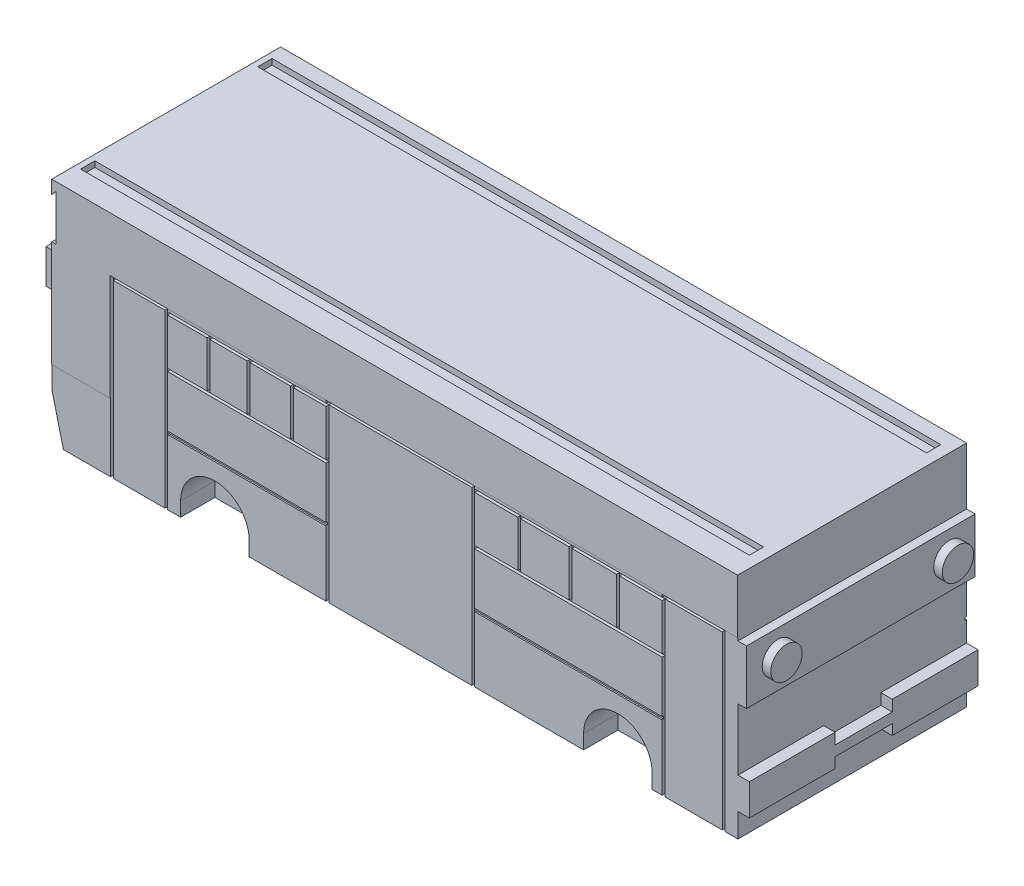
from build123d import *

# Parameters (mm, degrees)
BOSS_EXTRUDE2_DEPTH           = 40
CUT_EXTRUDE3_DEPTH            = 6
CUT_EXTRUDE4_DEPTH            = 6
CUT_EXTRUDE5_START            = -6
CUT_EXTRUDE5_DEPTH            = 6
CUT_EXTRUDE_THIN7_START       = -0.5
CUT_EXTRUDE_THIN7_OUTLINE_W   = 6.885880552
CUT_EXTRUDE_THIN7_OUTLINE_H   = 8.068048293
CUT_EXTRUDE_THIN7_OUTLINE_W_2 = 6.525346765
CUT_EXTRUDE_THIN7_OUTLINE_W_3 = 7.079873886
CUT_EXTRUDE_THIN7_OUTLINE_W_4 = 5.713011382
CUT_EXTRUDE_THIN7_OUTLINE_W_5 = 7.550261463
CUT_EXTRUDE_THIN7_OUTLINE_W_6 = 8.446736391
CUT_EXTRUDE_THIN7_OUTLINE_W_7 = 7.825435252
CUT_EXTRUDE_THIN7_OUTLINE_W_8 = 7.494074644
CUT_EXTRUDE_THIN7_DEPTH       = 1.5
SKETCH6_W                     = 21
SKETCH6_H                     = 11
SKETCH6_W_2                   = 20
SKETCH6_H_2                   = 10
SKETCH6_H_3                   = 0.5
SKETCH6_W_3                   = 0.5
SKETCH6_H_4                   = 5
CUT_EXTRUDE_THIN12_DEPTH      = 0.5
CUT_EXTRUDE_THIN13_DEPTH      = 0.5
SKETCH9_W                     = 40
SKETCH9_H                     = 8
CUT_EXTRUDE6_DEPTH            = 0.75
BOSS_EXTRUDE3_DEPTH           = 0.75
SKETCH15_W                    = 40
SKETCH15_H                    = 9.5
BOSS_EXTRUDE8_DEPTH           = 1.5
SKETCH16_R                    = 2.75
BOSS_EXTRUDE11_DEPTH          = 1.5
CUT_EXTRUDE_THIN15_DEPTH      = 0.25
BOSS_EXTRUDE13_DEPTH          = 0.05
SKETCH23_W                    = 27.704112585
SKETCH23_H                    = 0.5
CUT_EXTRUDE_THIN17_DEPTH      = 0.25
SKETCH25_W                    = 32.81650775
SKETCH25_H                    = 0.5
CUT_EXTRUDE_THIN18_DEPTH      = 0.25
BOSS_EXTRUDE15_DEPTH          = 2
SKETCH28_W                    = 14.258252003
SKETCH28_H                    = 6
BOSS_EXTRUDE17_DEPTH          = 2
SKETCH29_W                    = 2
SKETCH29_H                    = 6.5
BOSS_EXTRUDE18_DEPTH          = 2
SKETCH30_W                    = 117
SKETCH30_H                    = 2.5
CUT_EXTRUDE8_DEPTH            = 1
SKETCH14_W                    = 33
SKETCH14_H                    = 4
BOSS_EXTRUDE7_DEPTH           = 1.5
SKETCH31_R                    = 2.5
CUT_EXTRUDE9_DEPTH            = 5
SKETCH32_R                    = 2.5
CUT_EXTRUDE10_DEPTH           = 5
SKETCH33_R                    = 2.5
CUT_EXTRUDE11_DEPTH           = 5
SKETCH34_R                    = 2.5
CUT_EXTRUDE12_DEPTH           = 5


with BuildPart() as part:
    # Sketch1 → Boss-Extrude2 (new body)
    with BuildSketch(Plane.XY):
        Polygon((-58.90129441, -14.223203026), (-56.90129441, -22.223203026), (61.09870559, -22.223203026), (61.09870559, 17.776796974), (-58.90129441, 17.776796974), align=None)
    extrude(amount=BOSS_EXTRUDE2_DEPTH)

    # Sketch2 → Cut-Extrude3 (cut)
    with BuildSketch(Plane.XY.offset(40)):
        with BuildLine():
            Line((46.09870559, -19.723203026), (46.09870559, -24.723203026))
            ThreePointArc((46.09870559, -24.723203026), (40.09870559, -30.723203026), (34.09870559, -24.723203026))
            Line((34.09870559, -24.723203026), (34.09870559, -19.723203026))
            ThreePointArc((34.09870559, -19.723203026), (40.09870559, -13.723203026), (46.09870559, -19.723203026))
        make_face()
        with BuildLine():
            Line((-24.40129441, -19.723203026), (-24.40129441, -24.723203026))
            ThreePointArc((-24.40129441, -24.723203026), (-30.40129441, -30.723203026), (-36.40129441, -24.723203026))
            Line((-36.40129441, -24.723203026), (-36.40129441, -19.723203026))
            ThreePointArc((-36.40129441, -19.723203026), (-30.40129441, -13.723203026), (-24.40129441, -19.723203026))
        make_face()
    extrude(amount=-CUT_EXTRUDE3_DEPTH, mode=Mode.SUBTRACT)

    # Sketch3 → Cut-Extrude4 (cut)
    with BuildSketch(Plane(origin=(0, 0, 0), x_dir=(-1, 0, 0), z_dir=(0, 0, -1))):
        with BuildLine():
            Line((36.40129441, -19.723203026), (36.40129441, -24.723203026))
            ThreePointArc((36.40129441, -24.723203026), (31.306625077, -29.81787236), (26.211955744, -24.723203026))
            Line((26.211955744, -24.723203026), (26.211955744, -19.723203026))
            ThreePointArc((26.211955744, -19.723203026), (31.306625077, -14.628533693), (36.40129441, -19.723203026))
        make_face()
    extrude(amount=-CUT_EXTRUDE4_DEPTH, mode=Mode.SUBTRACT)

    # Sketch4 → Cut-Extrude5 (cut)
    with BuildSketch(Plane(origin=(0, 0, 0), x_dir=(-1, 0, 0), z_dir=(0, 0, -1)).offset(CUT_EXTRUDE5_START)):
        with BuildLine():
            Line((-34.09870559, -19.723203026), (-34.09870559, -24.723203026))
            ThreePointArc((-34.09870559, -24.723203026), (-40.09870559, -30.723203026), (-46.09870559, -24.723203026))
            Line((-46.09870559, -24.723203026), (-46.09870559, -19.723203026))
            ThreePointArc((-46.09870559, -19.723203026), (-40.09870559, -13.723203026), (-34.09870559, -19.723203026))
        make_face()
    extrude(amount=CUT_EXTRUDE5_DEPTH, mode=Mode.SUBTRACT)

    # Cut-Extrude-Thin7: read off the stored shape, not the designer's step
    # Cut-Extrude-Thin7 outline → Cut-Extrude-Thin7 (cut)
    with BuildSketch(Plane.XY.offset(40).offset(CUT_EXTRUDE_THIN7_START)):
        Polygon((-38.661608166, -1.291251319), (-10.957495581, -1.291251319), (-10.957495581, -22.223203026), (-10.457495581, -22.223203026), (-10.457495581, 7.776796974), (14.542504419, 7.776796974), (14.542504419, -22.223203026), (15.042504419, -22.223203026), (15.042504419, -1.291251319), (47.859012169, -1.291251319), (47.859012169, -22.223203026), (48.359012169, -22.223203026), (48.359012169, 7.776796974), (58.359012169, 7.776796974), (58.359012169, -22.223203026), (58.859012169, -22.223203026), (58.859012169, 8.276796974), (47.859012169, 8.276796974), (47.859012169, 7.776796974), (15.042504419, 7.776796974), (15.042504419, 8.276796974), (-10.957495581, 8.276796974), (-10.957495581, 7.776796974), (-38.661608166, 7.776796974), (-38.661608166, 8.276796974), (-48.661608166, 8.276796974), (-48.661608166, -22.223203026), (-48.161608166, -22.223203026), (-48.161608166, 7.776796974), (-39.161608166, 7.776796974), (-39.161608166, -22.223203026), (-38.661608166, -22.223203026), align=None)
        with Locations((-35.21866789, 3.242772828)):
            Rectangle(CUT_EXTRUDE_THIN7_OUTLINE_W, CUT_EXTRUDE_THIN7_OUTLINE_H, mode=Mode.SUBTRACT)
        with Locations((-28.013054231, 3.242772828)):
            Rectangle(CUT_EXTRUDE_THIN7_OUTLINE_W_2, CUT_EXTRUDE_THIN7_OUTLINE_H, mode=Mode.SUBTRACT)
        with Locations((-20.710443906, 3.242772828)):
            Rectangle(CUT_EXTRUDE_THIN7_OUTLINE_W_3, CUT_EXTRUDE_THIN7_OUTLINE_H, mode=Mode.SUBTRACT)
        with Locations((-13.814001272, 3.242772828)):
            Rectangle(CUT_EXTRUDE_THIN7_OUTLINE_W_4, CUT_EXTRUDE_THIN7_OUTLINE_H, mode=Mode.SUBTRACT)
        with Locations((18.817635151, 3.242772828)):
            Rectangle(CUT_EXTRUDE_THIN7_OUTLINE_W_5, CUT_EXTRUDE_THIN7_OUTLINE_H, mode=Mode.SUBTRACT)
        with Locations((27.316134078, 3.242772828)):
            Rectangle(CUT_EXTRUDE_THIN7_OUTLINE_W_6, CUT_EXTRUDE_THIN7_OUTLINE_H, mode=Mode.SUBTRACT)
        with Locations((35.952219899, 3.242772828)):
            Rectangle(CUT_EXTRUDE_THIN7_OUTLINE_W_7, CUT_EXTRUDE_THIN7_OUTLINE_H, mode=Mode.SUBTRACT)
        with Locations((44.111974847, 3.242772828)):
            Rectangle(CUT_EXTRUDE_THIN7_OUTLINE_W_8, CUT_EXTRUDE_THIN7_OUTLINE_H, mode=Mode.SUBTRACT)
    extrude(amount=CUT_EXTRUDE_THIN7_DEPTH, mode=Mode.SUBTRACT)

    # Sketch6 → Cut-Extrude-Thin12 (cut)
    # profile 1 of 12: a face of its own
    with BuildSketch(Plane(origin=(0, 0, 0), x_dir=(-1, 0, 0), z_dir=(0, 0, -1))):
        with Locations((26.899390959, 8.776796974)):
            Rectangle(SKETCH6_W, SKETCH6_H)
        with Locations((26.899390959, 8.776796974)):
            Rectangle(SKETCH6_W_2, SKETCH6_H_2, mode=Mode.SUBTRACT)
    # profile 2 of 12: a face of its own
    with BuildSketch(Plane(origin=(0, 0, 0), x_dir=(-1, 0, 0), z_dir=(0, 0, -1))):
        with Locations((26.899390959, 8.526796974)):
            Rectangle(SKETCH6_W_2, SKETCH6_H_3)
    # profile 3 of 12: a face of its own
    with BuildSketch(Plane(origin=(0, 0, 0), x_dir=(-1, 0, 0), z_dir=(0, 0, -1))):
        with Locations((27.149390959, 11.276796974)):
            Rectangle(SKETCH6_W_3, SKETCH6_H_4)
    # profile 4 of 12: a face of its own
    with BuildSketch(Plane(origin=(0, 0, 0), x_dir=(-1, 0, 0), z_dir=(0, 0, -1))):
        with Locations((2.899390959, 8.776796974)):
            Rectangle(SKETCH6_W, SKETCH6_H)
        with Locations((2.899390959, 8.776796974)):
            Rectangle(SKETCH6_W_2, SKETCH6_H_2, mode=Mode.SUBTRACT)
    # profile 5 of 12: a face of its own
    with BuildSketch(Plane(origin=(0, 0, 0), x_dir=(-1, 0, 0), z_dir=(0, 0, -1))):
        with Locations((2.899390959, 8.526796974)):
            Rectangle(SKETCH6_W_2, SKETCH6_H_3)
    # profile 6 of 12: a face of its own
    with BuildSketch(Plane(origin=(0, 0, 0), x_dir=(-1, 0, 0), z_dir=(0, 0, -1))):
        with Locations((3.149390959, 11.276796974)):
            Rectangle(SKETCH6_W_3, SKETCH6_H_4)
    # profile 7 of 12: a face of its own
    with BuildSketch(Plane(origin=(0, 0, 0), x_dir=(-1, 0, 0), z_dir=(0, 0, -1))):
        with Locations((-21.100609041, 8.776796974)):
            Rectangle(SKETCH6_W, SKETCH6_H)
        with Locations((-21.100609041, 8.776796974)):
            Rectangle(SKETCH6_W_2, SKETCH6_H_2, mode=Mode.SUBTRACT)
    # profile 8 of 12: a face of its own
    with BuildSketch(Plane(origin=(0, 0, 0), x_dir=(-1, 0, 0), z_dir=(0, 0, -1))):
        with Locations((-21.100609041, 8.526796974)):
            Rectangle(SKETCH6_W_2, SKETCH6_H_3)
    # profile 9 of 12: a face of its own
    with BuildSketch(Plane(origin=(0, 0, 0), x_dir=(-1, 0, 0), z_dir=(0, 0, -1))):
        with Locations((-20.850609041, 11.276796974)):
            Rectangle(SKETCH6_W_3, SKETCH6_H_4)
    # profile 10 of 12: a face of its own
    with BuildSketch(Plane(origin=(0, 0, 0), x_dir=(-1, 0, 0), z_dir=(0, 0, -1))):
        with Locations((-45.100609041, 8.776796974)):
            Rectangle(SKETCH6_W, SKETCH6_H)
        with Locations((-45.100609041, 8.776796974)):
            Rectangle(SKETCH6_W_2, SKETCH6_H_2, mode=Mode.SUBTRACT)
    # profile 11 of 12: a face of its own
    with BuildSketch(Plane(origin=(0, 0, 0), x_dir=(-1, 0, 0), z_dir=(0, 0, -1))):
        with Locations((-45.100609041, 8.526796974)):
            Rectangle(SKETCH6_W_2, SKETCH6_H_3)
    # profile 12 of 12: a face of its own
    with BuildSketch(Plane(origin=(0, 0, 0), x_dir=(-1, 0, 0), z_dir=(0, 0, -1))):
        with Locations((-44.850609041, 11.276796974)):
            Rectangle(SKETCH6_W_3, SKETCH6_H_4)
    extrude(amount=-CUT_EXTRUDE_THIN12_DEPTH, mode=Mode.SUBTRACT)

    # Sketch7 → Cut-Extrude-Thin13 (cut)
    with BuildSketch(Plane(origin=(0, 0, 0), x_dir=(-1, 0, 0), z_dir=(0, 0, -1))):
        Polygon((40.525511581, 14.492756681), (40.525511581, 1.641024263), (57.525511581, -4.462573548), (57.525511581, 14.492756681), align=None)
        Polygon((41.025511581, 13.992756681), (41.025511581, 1.992756681), (57.025511581, -3.751805966), (57.025511581, 13.992756681), align=None, mode=Mode.SUBTRACT)
    extrude(amount=-CUT_EXTRUDE_THIN13_DEPTH, mode=Mode.SUBTRACT)

    # Sketch9 → Cut-Extrude6 (cut)
    with BuildSketch(Plane.ZY.offset(58.90129441)):
        with Locations((20, 12.276796974)):
            Rectangle(SKETCH9_W, SKETCH9_H)
    extrude(amount=-CUT_EXTRUDE6_DEPTH, mode=Mode.SUBTRACT)

    # Sketch10 → Boss-Extrude3 (add)
    # profile 1 of 8: a face of its own
    with BuildSketch(Plane.ZY.offset(58.15129441)):
        Polygon((7.686698718, 9.703342352), (8.105834335, 12.878342352), (8.146539463, 12.878342352), (9.457371795, 10.273214147), (10.765024038, 12.878342352), (10.806365184, 12.878342352), (11.228044872, 9.703342352), (10.941836939, 9.703342352), (10.637820513, 11.987917673), (9.491716747, 9.703342352), (9.427478966, 9.703342352), (8.276923077, 11.993005814), (7.973542668, 9.703342352), align=None)
    # profile 2 of 8: a face of its own
    with BuildSketch(Plane.ZY.offset(58.15129441)):
        Polygon((11.879326923, 12.878342352), (13.670352564, 12.878342352), (13.670352564, 12.552701326), (12.164262821, 12.552701326), (12.164262821, 11.57577825), (13.670352564, 11.57577825), (13.670352564, 11.250137224), (12.164262821, 11.250137224), (12.164262821, 10.028983378), (13.670352564, 10.028983378), (13.670352564, 9.703342352), (11.879326923, 9.703342352), align=None)
    # profile 3 of 8: a face of its own
    with BuildSketch(Plane.ZY.offset(58.15129441)):
        with BuildLine():
            Line((17.211698718, 12.336455333), (16.967467949, 12.104944916))
            add(Edge.make_bspline(
                [(16.967467949, 12.104944916), (16.923272957, 12.146520056), (16.835936829, 12.228678953), (16.693551466, 12.335278213), (16.544994456, 12.426596747), (16.391040976, 12.500897404), (16.235503574, 12.560181694), (16.080446755, 12.602389364), (15.927461012, 12.629306595), (15.825709321, 12.632525472), (15.775570913, 12.634111583)],
                knots=[0, 0, 0, 0, 1.08915593, 2.152340314, 3.188132944, 4.216796309, 5.218260357, 6.173443236, 7.099959455, 8, 8, 8, 8], degree=3))
            add(Edge.make_bspline(
                [(15.775570913, 12.634111583), (15.744805436, 12.633736383), (15.683354272, 12.632986957), (15.592075794, 12.623421847), (15.50175463, 12.609665149), (15.412561283, 12.589760732), (15.324322331, 12.564533942), (15.237344664, 12.532978558), (15.151466035, 12.496189157), (15.067495376, 12.453678199), (14.986087919, 12.406978624), (14.909201361, 12.355227448), (14.836345635, 12.300083332), (14.768890106, 12.240165657), (14.706446758, 12.176017172), (14.647529307, 12.108831173), (14.594209902, 12.036772082), (14.546048631, 11.961165693), (14.503084878, 11.883339921), (14.465158456, 11.804043852), (14.433320383, 11.723540498), (14.40812952, 11.641728842), (14.387346284, 11.559241807), (14.372725312, 11.475508239), (14.364482357, 11.390438482), (14.363056528, 11.333472397), (14.362339744, 11.30483474)],
                knots=[0, 0, 0, 0, 1.02818874, 2.053710826, 3.065248034, 4.081641283, 5.106893873, 6.131558223, 7.173050175, 8.228653731, 9.27666206, 10.308777013, 11.325269123, 12.329503258, 13.32196095, 14.316845687, 15.314881793, 16.315733098, 17.311955233, 18.285320748, 19.252783886, 20.203351036, 21.145449891, 22.095197417, 23.042428769, 24, 24, 24, 24], degree=3))
            add(Edge.make_bspline(
                [(14.362339744, 11.30483474), (14.363025288, 11.275560499), (14.364394505, 11.217091954), (14.373157795, 11.129830188), (14.38942127, 11.04386443), (14.411163406, 10.958912195), (14.438360289, 10.874827992), (14.472262636, 10.791976358), (14.512417859, 10.71036036), (14.558896731, 10.630715379), (14.609865644, 10.553133779), (14.666964011, 10.480054785), (14.727616111, 10.410505251), (14.794031578, 10.34602938), (14.864080734, 10.284902559), (14.939856441, 10.228808907), (15.019868673, 10.176667948), (15.104239501, 10.129136819), (15.192053454, 10.086674791), (15.282093509, 10.04891597), (15.374647313, 10.017819715), (15.469228467, 9.992475863), (15.565724221, 9.971702022), (15.664624384, 9.958337558), (15.76520177, 9.948639447), (15.833000386, 9.94793036), (15.867157452, 9.947573121)],
                knots=[0, 0, 0, 0, 0.93586088, 1.869166235, 2.799637598, 3.729985548, 4.670839027, 5.622275134, 6.589130586, 7.576015415, 8.568469353, 9.55398029, 10.53834874, 11.515998671, 12.510579167, 13.508179873, 14.527009472, 15.561807829, 16.601455013, 17.643573243, 18.680854198, 19.719860599, 20.772568776, 21.833555941, 22.908541556, 24, 24, 24, 24], degree=3))
            add(Edge.make_bspline(
                [(15.867157452, 9.947573121), (15.908322095, 9.948433616), (15.989155561, 9.950123336), (16.107978977, 9.96327717), (16.222100334, 9.983821047), (16.331198961, 10.013907253), (16.435401573, 10.05228273), (16.53509017, 10.09854283), (16.629479888, 10.154461891), (16.718854482, 10.217575328), (16.801184214, 10.287892354), (16.875437598, 10.363769824), (16.940430292, 10.444839428), (16.997130983, 10.530623678), (17.04403812, 10.621832633), (17.082539798, 10.718019315), (17.112052141, 10.819226986), (17.124167011, 10.889160109), (17.130288462, 10.924496198)],
                knots=[0, 0, 0, 0, 1.13008108, 2.219097802, 3.278683437, 4.311054135, 5.322181354, 6.324827112, 7.324222904, 8.330512327, 9.32562643, 10.293043162, 11.24128371, 12.174520618, 13.111833804, 14.052305215, 15.015860969, 16, 16, 16, 16], degree=3))
            Line((17.130288462, 10.924496198), (16.071955128, 10.924496198))
            Line((16.071955128, 10.924496198), (16.071955128, 11.250137224))
            Line((16.071955128, 11.250137224), (17.415224359, 11.250137224))
            add(Edge.make_bspline(
                [(17.415224359, 11.250137224), (17.413676911, 11.189442573), (17.410648275, 11.070652178), (17.389403973, 10.897414861), (17.355098994, 10.733791968), (17.308235711, 10.579611182), (17.247570278, 10.435090994), (17.17375377, 10.300084672), (17.085604775, 10.175464398), (16.98626316, 10.060212801), (16.874775341, 9.957407016), (16.754153807, 9.867050201), (16.624199272, 9.790938543), (16.485034661, 9.72901637), (16.337115553, 9.680689246), (16.180099666, 9.64642503), (16.014199928, 9.625896421), (15.900501657, 9.623273527), (15.842352764, 9.621932096)],
                knots=[0, 0, 0, 0, 1.140356446, 2.231883559, 3.274166699, 4.278491846, 5.25512956, 6.21435461, 7.1637429, 8.11826594, 9.068280886, 10.0076534, 10.945064095, 11.891975133, 12.864533718, 13.863980011, 14.907571808, 16, 16, 16, 16], degree=3))
            add(Edge.make_bspline(
                [(15.842352764, 9.621932096), (15.806511427, 9.62244837), (15.735820759, 9.623466629), (15.631416846, 9.630703223), (15.529891576, 9.64184346), (15.431259739, 9.658666536), (15.335158529, 9.679271973), (15.242067905, 9.705657782), (15.151633254, 9.736200102), (15.063714795, 9.770939748), (14.979110528, 9.81119118), (14.897443616, 9.855922067), (14.81826263, 9.904901759), (14.742106931, 9.958977312), (14.668579717, 10.017744258), (14.598155093, 10.081320384), (14.530438804, 10.149511328), (14.488020383, 10.197933716), (14.466646635, 10.222332737)],
                knots=[0, 0, 0, 0, 1.107784379, 2.184907829, 3.233506516, 4.263428166, 5.276301166, 6.270063455, 7.25232949, 8.225834625, 9.190232166, 10.146266622, 11.1027726, 12.066435141, 13.031522626, 14.010570082, 14.99756817, 16, 16, 16, 16], degree=3))
            add(Edge.make_bspline(
                [(14.466646635, 10.222332737), (14.435635111, 10.261041115), (14.374126822, 10.337815352), (14.294953066, 10.460823873), (14.227460365, 10.588188417), (14.172698126, 10.720263545), (14.129937148, 10.856925716), (14.099270047, 10.998000302), (14.081302006, 11.143668967), (14.07871344, 11.242243885), (14.077403846, 11.292114387)],
                knots=[0, 0, 0, 0, 1.023165419, 2.029347347, 3.013907458, 3.994755782, 4.975994455, 5.96558838, 6.970761222, 8, 8, 8, 8], degree=3))
            add(Edge.make_bspline(
                [(14.077403846, 11.292114387), (14.077886662, 11.329458059), (14.078846158, 11.403670788), (14.090480733, 11.513849917), (14.107173448, 11.622072688), (14.131708991, 11.728250635), (14.162639174, 11.832454672), (14.201241264, 11.934733182), (14.246185563, 12.035146523), (14.298423834, 12.133003532), (14.356557594, 12.227005678), (14.41964958, 12.316774542), (14.488595703, 12.400675337), (14.562270035, 12.479770618), (14.641551591, 12.553066715), (14.725697639, 12.621242229), (14.814773029, 12.684388612), (14.909057992, 12.741511248), (15.007145249, 12.792822532), (15.108799679, 12.837807032), (15.213990251, 12.874984753), (15.321928891, 12.906529539), (15.433432624, 12.929856845), (15.547692289, 12.946773921), (15.665303462, 12.958349608), (15.74480186, 12.959280569), (15.785111178, 12.959752608)],
                knots=[0, 0, 0, 0, 1.008945113, 2.00506715, 2.99143336, 3.967273523, 4.948097931, 5.927297278, 6.919902385, 7.919676788, 8.923139349, 9.905703106, 10.883022732, 11.856032218, 12.825136022, 13.798837087, 14.781400844, 15.773989409, 16.776158564, 17.77167057, 18.775803737, 19.789618931, 20.80898985, 21.851988756, 22.910860228, 24, 24, 24, 24], degree=3))
            add(Edge.make_bspline(
                [(15.785111178, 12.959752608), (15.817984442, 12.959226927), (15.883168261, 12.958184561), (15.980165175, 12.950959488), (16.075662839, 12.939507824), (16.169802849, 12.923880668), (16.262264625, 12.902595749), (16.353311564, 12.877124733), (16.443075651, 12.84746858), (16.531275563, 12.812100126), (16.618504348, 12.771955767), (16.705247017, 12.726767876), (16.791207191, 12.675763765), (16.876533938, 12.618791986), (16.961765323, 12.556831029), (17.045553249, 12.488108767), (17.129920206, 12.415335267), (17.184168994, 12.363009286), (17.211698718, 12.336455333)],
                knots=[0, 0, 0, 0, 0.985871117, 1.954866573, 2.915460327, 3.869826059, 4.81536089, 5.759505086, 6.70452669, 7.649098992, 8.607881297, 9.583363685, 10.581137262, 11.603961102, 12.659522466, 13.73993555, 14.853081303, 16, 16, 16, 16], degree=3))
        make_face()
    # profile 4 of 8: a face of its own
    with BuildSketch(Plane.ZY.offset(58.15129441)):
        Polygon((19.369070513, 12.878342352), (20.834455128, 9.703342352), (20.524714543, 9.703342352), (20.055333534, 10.720970557), (18.616025641, 10.720970557), (18.133288261, 9.703342352), (17.822275641, 9.703342352), (19.328365385, 12.878342352), align=None)
        Polygon((19.345537861, 12.2594972), (18.770577925, 11.046611583), (19.905233373, 11.046611583), align=None, mode=Mode.SUBTRACT)
    # profile 5 of 8: a face of its own
    with BuildSketch(Plane.ZY.offset(58.15129441)):
        Polygon((21.037980769, 12.552701326), (21.037980769, 12.878342352), (22.706891026, 12.878342352), (22.706891026, 12.552701326), (22.014903846, 12.552701326), (22.014903846, 9.703342352), (21.729967949, 9.703342352), (21.729967949, 12.552701326), align=None)
    # profile 6 of 8: a face of its own
    with BuildSketch(Plane.ZY.offset(58.15129441)):
        with BuildLine():
            Line((23.195352564, 12.878342352), (23.830734175, 12.878342352))
            add(Edge.make_bspline(
                [(23.830734175, 12.878342352), (23.873135056, 12.878201213), (23.954549444, 12.877930211), (24.071183768, 12.876419126), (24.177162634, 12.872088104), (24.272430631, 12.868361032), (24.356986011, 12.861564771), (24.431088053, 12.855069041), (24.494395465, 12.846565791), (24.532718487, 12.838668729), (24.550070112, 12.835093153)],
                knots=[0, 0, 0, 0, 1.410062039, 2.707475311, 3.878576406, 4.937260626, 5.877586885, 6.699081471, 7.410979367, 8, 8, 8, 8], degree=3))
            add(Edge.make_bspline(
                [(24.550070112, 12.835093153), (24.573298978, 12.829353873), (24.619261176, 12.817997748), (24.685437307, 12.79399511), (24.74849673, 12.766218736), (24.808177499, 12.733594504), (24.864180681, 12.69588024), (24.91708372, 12.653727014), (24.967126676, 12.607365478), (25.012285726, 12.555626729), (25.054866152, 12.501346466), (25.090778692, 12.442650915), (25.121736284, 12.381272244), (25.146383824, 12.316586229), (25.166230272, 12.249220193), (25.180224075, 12.178563928), (25.188616223, 12.104939329), (25.189470621, 12.054721797), (25.189903846, 12.029258818)],
                knots=[0, 0, 0, 0, 1.027469482, 2.033020251, 3.019912614, 3.986113645, 4.951240523, 5.91722682, 6.890402269, 7.87763091, 8.8651537, 9.85103654, 10.82876324, 11.815024772, 12.821070561, 13.842952187, 14.906261191, 16, 16, 16, 16], degree=3))
            add(Edge.make_bspline(
                [(25.189903846, 12.029258818), (25.188571255, 11.986954116), (25.185971025, 11.904406686), (25.161727538, 11.7846086), (25.12201598, 11.672858293), (25.06729414, 11.569296472), (24.997607901, 11.475941815), (24.913856126, 11.393944759), (24.815992093, 11.325328553), (24.724888356, 11.277746366), (24.644411904, 11.247272798), (24.578160256, 11.225831244), (24.505890926, 11.209265033), (24.428296344, 11.194424056), (24.345053599, 11.183219305), (24.256362207, 11.175012751), (24.162158912, 11.169883721), (24.097444185, 11.169119903), (24.064152644, 11.168726967)],
                knots=[0, 0, 0, 0, 1.260483769, 2.459530307, 3.627416485, 4.787058657, 5.939039949, 7.08810263, 8.267026773, 9.491475466, 10.141966685, 10.831826277, 11.566392101, 12.351337768, 13.187381173, 14.07005841, 15.007169909, 16, 16, 16, 16], degree=3))
            Line((24.064152644, 11.168726967), (25.230608974, 9.703342352))
            Line((25.230608974, 9.703342352), (24.878255208, 9.703342352))
            Line((24.878255208, 9.703342352), (23.711798878, 11.168726967))
            Line((23.711798878, 11.168726967), (23.480288462, 11.168726967))
            Line((23.480288462, 11.168726967), (23.480288462, 9.703342352))
            Line((23.480288462, 9.703342352), (23.195352564, 9.703342352))
            Line((23.195352564, 9.703342352), (23.195352564, 12.878342352))
        make_face()
        with BuildLine():
            Line((23.480288462, 12.552701326), (23.480288462, 11.494367993))
            Line((23.480288462, 11.494367993), (24.061608574, 11.48991587))
            add(Edge.make_bspline(
                [(24.061608574, 11.48991587), (24.088750323, 11.489903862), (24.141358764, 11.489880588), (24.217468653, 11.493503514), (24.288334755, 11.497624952), (24.353686008, 11.503929002), (24.413551609, 11.512053438), (24.467901634, 11.522216145), (24.516824802, 11.534056231), (24.573882762, 11.552381991), (24.63759733, 11.581416022), (24.706840868, 11.623657582), (24.765807275, 11.67678814), (24.815625621, 11.737542632), (24.85565732, 11.804341229), (24.883880398, 11.876383221), (24.901789613, 11.951849885), (24.903901936, 12.003718597), (24.904967949, 12.029894836)],
                knots=[0, 0, 0, 0, 1.146690395, 2.22261258, 3.21895312, 4.145990853, 4.996080663, 5.770904154, 6.481378293, 7.121626537, 8.300444488, 9.431385265, 10.535395872, 11.636531494, 12.74115979, 13.810798291, 14.895190096, 16, 16, 16, 16], degree=3))
            add(Edge.make_bspline(
                [(24.904967949, 12.029894836), (24.903877453, 12.055427799), (24.901716489, 12.106024816), (24.884073677, 12.180098392), (24.85423831, 12.250009125), (24.814031709, 12.315472622), (24.765046761, 12.374895682), (24.707608459, 12.425738457), (24.643287318, 12.467693329), (24.583169874, 12.494503374), (24.529435981, 12.510940669), (24.482781932, 12.522507796), (24.43006652, 12.531800993), (24.371033783, 12.539246877), (24.305935732, 12.545646719), (24.234443213, 12.549957261), (24.157030562, 12.552509838), (24.103375846, 12.552636012), (24.075600962, 12.552701326)],
                knots=[0, 0, 0, 0, 1.101028733, 2.181837193, 3.264309656, 4.369019818, 5.486613113, 6.575447106, 7.666700264, 8.788928104, 9.402425223, 10.0903467, 10.862060571, 11.710948788, 12.657782767, 13.684531032, 14.801375019, 16, 16, 16, 16], degree=3))
            Line((24.075600962, 12.552701326), (23.480288462, 12.552701326))
        make_face(mode=Mode.SUBTRACT)
    # profile 7 of 8: a face of its own
    with BuildSketch(Plane.ZY.offset(58.15129441)):
        with BuildLine():
            add(Edge.make_bspline(
                [(27.367628205, 12.959752608), (27.426418415, 12.958263552), (27.541887239, 12.955338923), (27.711590896, 12.93295145), (27.873602161, 12.894220632), (28.029240787, 12.842637784), (28.17664513, 12.77382702), (28.316924697, 12.690655493), (28.449745718, 12.592251848), (28.573317972, 12.479376763), (28.686399634, 12.35656463), (28.786027402, 12.225502526), (28.869522911, 12.086982898), (28.938090018, 11.941422002), (28.991882328, 11.789149031), (29.029001746, 11.629352186), (29.052712783, 11.463066831), (29.055484809, 11.349649604), (29.056891026, 11.292114387)],
                knots=[0, 0, 0, 0, 1.065120563, 2.091984664, 3.0946048, 4.079830382, 5.057816894, 6.036188127, 7.030412546, 8.04752943, 9.064399622, 10.05169764, 11.02544977, 11.989514704, 12.962713494, 13.945757189, 14.957906945, 16, 16, 16, 16], degree=3))
            add(Edge.make_bspline(
                [(29.056891026, 11.292114387), (29.055485015, 11.23500299), (29.052713606, 11.122429808), (29.028974787, 10.957199684), (28.991744737, 10.798367409), (28.938589552, 10.646198138), (28.870349297, 10.500531348), (28.78629782, 10.361750326), (28.687291151, 10.229809574), (28.574617793, 10.106154513), (28.451789705, 9.992763951), (28.320045106, 9.89395897), (28.18234688, 9.8089378), (28.036923073, 9.741098325), (27.885702325, 9.686876654), (27.727331218, 9.649908197), (27.562551844, 9.626062093), (27.450183148, 9.623323868), (27.39306891, 9.621932096)],
                knots=[0, 0, 0, 0, 1.043624062, 2.057103931, 3.04512605, 4.022047818, 4.998200453, 5.980619268, 6.982898556, 8.009068085, 9.034988726, 10.034168286, 11.015286542, 11.987931943, 12.962482838, 13.94673481, 14.956375938, 16, 16, 16, 16], degree=3))
            add(Edge.make_bspline(
                [(27.39306891, 9.621932096), (27.335533992, 9.623337611), (27.222117354, 9.626108256), (27.055623043, 9.64985853), (26.895713947, 9.686998141), (26.742847357, 9.740074558), (26.596938028, 9.808670189), (26.457700596, 9.892312733), (26.325693941, 9.99156064), (26.202012499, 10.104197461), (26.088847155, 10.226817369), (25.990186864, 10.358202729), (25.906525511, 10.495775893), (25.838160203, 10.639918647), (25.784036015, 10.78993417), (25.747110929, 10.946823146), (25.723220459, 11.109691126), (25.720467419, 11.220582898), (25.719070513, 11.276849964)],
                knots=[0, 0, 0, 0, 1.053102029, 2.075944431, 3.073151272, 4.055350789, 5.033113405, 6.020478099, 7.024410459, 8.052272461, 9.079885166, 10.07527673, 11.055994387, 12.023226415, 12.992069828, 13.970394897, 14.97016774, 16, 16, 16, 16], degree=3))
            add(Edge.make_bspline(
                [(25.719070513, 11.276849964), (25.719555504, 11.314616743), (25.720519367, 11.389673855), (25.732123259, 11.501131413), (25.748961374, 11.61079651), (25.773093109, 11.718357299), (25.804654121, 11.823550478), (25.841894174, 11.927101527), (25.887378177, 12.027961048), (25.938795622, 12.126606839), (25.996183119, 12.221501153), (26.059570406, 12.311199061), (26.126731062, 12.396453251), (26.200357855, 12.475054461), (26.278024202, 12.549289278), (26.360990016, 12.618016886), (26.448749052, 12.68185702), (26.541678925, 12.739388329), (26.637489789, 12.791421259), (26.73625658, 12.836072509), (26.836637898, 12.874395722), (26.9391039, 12.905457042), (27.043382487, 12.92997896), (27.149701248, 12.94667706), (27.257975485, 12.958310548), (27.330920039, 12.959269854), (27.367628205, 12.959752608)],
                knots=[0, 0, 0, 0, 1.037015668, 2.060948919, 3.074880161, 4.083647147, 5.086022904, 6.090072063, 7.104153813, 8.122640571, 9.144368836, 10.147691507, 11.138137339, 12.123020368, 13.103399296, 14.087645067, 15.080126199, 16.082011238, 17.087798457, 18.072939717, 19.057185487, 20.037253025, 21.01195951, 21.997135196, 22.992090687, 24, 24, 24, 24], degree=3))
        make_face()
        with BuildLine():
            add(Edge.make_bspline(
                [(27.381620593, 12.634111583), (27.351490175, 12.63374429), (27.291517389, 12.633013214), (27.202359274, 12.623383244), (27.114373734, 12.609658273), (27.027542598, 12.590080751), (26.942229179, 12.563407074), (26.857638251, 12.532708536), (26.774541195, 12.495315118), (26.693212339, 12.453067022), (26.614367949, 12.406304787), (26.539970713, 12.354623255), (26.469828029, 12.299234424), (26.404111637, 12.240009029), (26.343014502, 12.176645461), (26.285334094, 12.110104323), (26.233382402, 12.038483679), (26.185770486, 11.963725667), (26.143163945, 11.885927661), (26.105276802, 11.805908714), (26.074285165, 11.723016099), (26.04901001, 11.638149113), (26.028055181, 11.551442167), (26.014780122, 11.462237504), (26.005044339, 11.370983367), (26.00435505, 11.309314114), (26.00400641, 11.278122)],
                knots=[0, 0, 0, 0, 1.008559885, 2.007477868, 2.99961109, 3.989939068, 4.984837346, 5.991145699, 7.001802488, 8.033829008, 9.059044045, 10.069351652, 11.065060232, 12.050310815, 13.029377138, 14.011219647, 14.996725999, 15.989392538, 16.977580475, 17.965360261, 18.951710183, 19.937753436, 20.929683414, 21.935841486, 22.955955122, 24, 24, 24, 24], degree=3))
            add(Edge.make_bspline(
                [(26.00400641, 11.278122), (26.005162892, 11.232254842), (26.00743805, 11.142019954), (26.027356703, 11.009787423), (26.058038065, 10.882707335), (26.103265819, 10.761475032), (26.159826734, 10.645048432), (26.229701127, 10.534460366), (26.312486155, 10.429680944), (26.406523783, 10.331441664), (26.509323666, 10.241774399), (26.618482643, 10.163067593), (26.732831272, 10.096474009), (26.852667749, 10.042222265), (26.977352302, 9.999233003), (27.107688367, 9.969770244), (27.242807712, 9.950379653), (27.334910521, 9.94851751), (27.381620593, 9.947573121)],
                knots=[0, 0, 0, 0, 1.032063989, 2.030389145, 3.003944642, 3.970395727, 4.937377036, 5.913328081, 6.909231446, 7.93887556, 8.970685674, 9.976071282, 10.964166581, 11.944589148, 12.933237628, 13.927779006, 14.949070134, 16, 16, 16, 16], degree=3))
            add(Edge.make_bspline(
                [(27.381620593, 9.947573121), (27.413016355, 9.948004472), (27.475283581, 9.948859969), (27.567898805, 9.957476626), (27.658845511, 9.971294107), (27.747996137, 9.991188345), (27.835249501, 10.016086882), (27.920969787, 10.04566675), (28.00424395, 10.082570413), (28.086122517, 10.123344626), (28.164496251, 10.169826769), (28.239313341, 10.219754234), (28.30868798, 10.275061482), (28.374355209, 10.333406927), (28.435703184, 10.395966989), (28.492317048, 10.462660333), (28.544006168, 10.533907929), (28.591600005, 10.608552547), (28.63405725, 10.686563433), (28.671049718, 10.766872498), (28.702433338, 10.84928199), (28.727768481, 10.933910773), (28.747621722, 11.020598115), (28.761301363, 11.109460085), (28.770870304, 11.200318918), (28.771591553, 11.261772273), (28.771955128, 11.292750405)],
                knots=[0, 0, 0, 0, 1.047197238, 2.076906641, 3.100256066, 4.114471768, 5.12198147, 6.126382909, 7.136867548, 8.15857795, 9.17633901, 10.174870724, 11.156907918, 12.133735059, 13.104061851, 14.077631395, 15.04955518, 16.038496417, 17.029181396, 18.010275684, 18.986308667, 19.968651475, 20.955262928, 21.950658345, 22.966943676, 24, 24, 24, 24], degree=3))
            add(Edge.make_bspline(
                [(28.771955128, 11.292750405), (28.771591261, 11.323516612), (28.770869465, 11.384547052), (28.761305934, 11.474772223), (28.747607269, 11.562994779), (28.727865384, 11.648868372), (28.702419888, 11.732414891), (28.671044238, 11.813555869), (28.634046145, 11.892593589), (28.591584398, 11.969332702), (28.54385433, 12.042969785), (28.491698838, 12.113366259), (28.434217415, 12.179200103), (28.373052378, 12.242096576), (28.306675932, 12.300714233), (28.235388751, 12.355072519), (28.160056272, 12.406483275), (28.080293708, 12.452861464), (27.997975979, 12.495691518), (27.913508317, 12.532386356), (27.827847634, 12.563566779), (27.74121176, 12.590161454), (27.652871487, 12.609581596), (27.563423728, 12.623395612), (27.472992236, 12.633009863), (27.412174458, 12.633743177), (27.381620593, 12.634111583)],
                knots=[0, 0, 0, 0, 1.02996197, 2.043119294, 3.035359645, 4.018872909, 4.991431989, 5.957985074, 6.929999688, 7.912076566, 8.892894881, 9.867085534, 10.843653904, 11.817741046, 12.803660682, 13.806313499, 14.818574707, 15.856120519, 16.894564902, 17.924820532, 18.937903209, 19.946497019, 20.957711757, 21.963978472, 22.977135795, 24, 24, 24, 24], degree=3))
        make_face(mode=Mode.SUBTRACT)
    # profile 8 of 8: a face of its own
    with BuildSketch(Plane.ZY.offset(58.15129441)):
        Polygon((29.708173077, 9.703342352), (29.708173077, 12.878342352), (29.767958734, 12.878342352), (31.865544872, 10.379429091), (31.865544872, 12.878342352), (32.150480769, 12.878342352), (32.150480769, 9.703342352), (32.085606971, 9.703342352), (29.993108974, 12.196531455), (29.993108974, 9.703342352), align=None)
    extrude(amount=BOSS_EXTRUDE3_DEPTH)

    # Sketch15 → Boss-Extrude8 (add)
    with BuildSketch(Plane(origin=(61.09870559, 0, 0), x_dir=(0, 0, -1), z_dir=(1, 0, 0))):
        with Locations((-20, 3.026796974)):
            Rectangle(SKETCH15_W, SKETCH15_H)
    extrude(amount=BOSS_EXTRUDE8_DEPTH)

    # Sketch16 → Boss-Extrude11 (add)
    with BuildSketch(Plane(origin=(62.59870559, 0, 0), x_dir=(0, 0, -1), z_dir=(1, 0, 0))):
        with Locations(Location((-34.5, 3.276796974, 0), (0, 0, 180))):
            Circle(SKETCH16_R)
        with Locations(Location((-4.5, 3.276796974, 0), (0, 0, 180))):
            Circle(SKETCH16_R)
    extrude(amount=BOSS_EXTRUDE11_DEPTH)

    # Sketch17 → Cut-Extrude-Thin15 (cut)
    with BuildSketch(Plane(origin=(0, 0, 0), x_dir=(-1, 0, 0), z_dir=(0, 0, -1))):
        Polygon((-61.59870559, -1.969412415), (39.980767492, -1.723008776), (62.023793409, -8.968201025), (-61.59870559, -8.968201025), align=None)
        Polygon((-61.09870559, -2.468201025), (39.90129441, -2.223203026), (58.90129441, -8.468201025), (-61.09870559, -8.468201025), align=None, mode=Mode.SUBTRACT)
    extrude(amount=-CUT_EXTRUDE_THIN15_DEPTH, mode=Mode.SUBTRACT)

    # Sketch22 → Boss-Extrude13 (add)
    with BuildSketch(Plane.XY.offset(40)):
        Polygon((-58.90129441, -10.310990593), (-48.661608166, -10.310990593), (-48.661608166, 8.276796974), (61.09870559, 8.276796974), (61.09870559, 17.776796974), (-58.90129441, 17.776796974), (-58.90129441, 15.41708954), (-58.15129441, 16.276796974), (-58.15129441, 8.276796974), (-58.90129441, 8.276796974), align=None)
    extrude(amount=BOSS_EXTRUDE13_DEPTH)

    # Sketch23 → Cut-Extrude-Thin17 (cut)
    with BuildSketch(Plane.XY.offset(40)):
        with Locations((-24.809551873, -10.560990593)):
            Rectangle(SKETCH23_W, SKETCH23_H)
    extrude(amount=-CUT_EXTRUDE_THIN17_DEPTH, mode=Mode.SUBTRACT)

    # Sketch25 → Cut-Extrude-Thin18 (cut)
    with BuildSketch(Plane.XY.offset(40)):
        with Locations((31.450758294, -10.560990593)):
            Rectangle(SKETCH25_W, SKETCH25_H)
    extrude(amount=-CUT_EXTRUDE_THIN18_DEPTH, mode=Mode.SUBTRACT)

    # Sketch26 → Boss-Extrude15 (add)
    with BuildSketch(Plane(origin=(61.09870559, 0, 0), x_dir=(0, 0, -1), z_dir=(1, 0, 0))):
        Polygon((-25, -12.541674871), (-40, -12.541674871), (-40, -18.041674871), (-25, -18.041674871), (-25, -16.240243999), (-15, -16.240243999), (-15, -18.041674871), (0, -18.041674871), (0, -12.541674871), (-15, -12.541674871), (-15, -14.471363112), (-25, -14.471363112), align=None)
    extrude(amount=BOSS_EXTRUDE15_DEPTH)

    # Sketch28 → Boss-Extrude17 (add)
    with BuildSketch(Plane.ZY.offset(58.90129441)):
        with Locations((31.920873999, 3.058114765)):
            Rectangle(SKETCH28_W, SKETCH28_H)
        with Locations((8.129126002, 3.058114765)):
            Rectangle(SKETCH28_W, SKETCH28_H)
    extrude(amount=BOSS_EXTRUDE17_DEPTH)

    # Sketch29 → Boss-Extrude18 (add)
    with BuildSketch(Plane.ZY.offset(58.90129441)):
        with Locations((20.087207955, -9.252175832)):
            Rectangle(SKETCH29_W, SKETCH29_H)
        with Locations((14.087207955, -9.252175832)):
            Rectangle(SKETCH29_W, SKETCH29_H)
        with Locations((26.087207955, -9.252175832)):
            Rectangle(SKETCH29_W, SKETCH29_H)
    extrude(amount=BOSS_EXTRUDE18_DEPTH)

    # Sketch30 → Cut-Extrude8 (cut)
    with BuildSketch(Plane(origin=(0, 17.776796974, 0), x_dir=(1, 0, 0), z_dir=(0, 1, 0))):
        with Locations((0.59870559, -3.75)):
            Rectangle(SKETCH30_W, SKETCH30_H)
        with Locations((0.59870559, -34.75)):
            Rectangle(SKETCH30_W, SKETCH30_H)
    extrude(amount=-CUT_EXTRUDE8_DEPTH, mode=Mode.SUBTRACT)

    # Sketch14 → Boss-Extrude7 (add)
    with BuildSketch(Plane(origin=(-58.783148392, -14.695787098, 0), x_dir=(0, 0, 1), z_dir=(-0.9701425001453317, -0.24253562503633397, 0))):
        with Locations((20, -3.512871489)):
            Rectangle(SKETCH14_W, SKETCH14_H)
    extrude(amount=BOSS_EXTRUDE7_DEPTH)

    # Sketch31 → Cut-Extrude9 (cut)
    with BuildSketch(Plane.XY.offset(34)):
        with Locations((-30.433902079, -18.630195186)):
            Circle(SKETCH31_R)
    extrude(amount=-CUT_EXTRUDE9_DEPTH, mode=Mode.SUBTRACT)

    # Sketch32 → Cut-Extrude10 (cut)
    with BuildSketch(Plane(origin=(0, 0, 6), x_dir=(-1, 0, 0), z_dir=(0, 0, -1))):
        with Locations((31.313446929, -18.811250378)):
            Circle(SKETCH32_R)
    extrude(amount=-CUT_EXTRUDE10_DEPTH, mode=Mode.SUBTRACT)

    # Sketch33 → Cut-Extrude11 (cut)
    with BuildSketch(Plane(origin=(0, 0, 6), x_dir=(-1, 0, 0), z_dir=(0, 0, -1))):
        with Locations((-40.243877337, -18.624660224)):
            Circle(SKETCH33_R)
    extrude(amount=-CUT_EXTRUDE11_DEPTH, mode=Mode.SUBTRACT)

    # Sketch34 → Cut-Extrude12 (cut)
    with BuildSketch(Plane.XY.offset(34)):
        with Locations((39.97831694, -18.231964734)):
            Circle(SKETCH34_R)
    extrude(amount=-CUT_EXTRUDE12_DEPTH, mode=Mode.SUBTRACT)


solid = part.part
